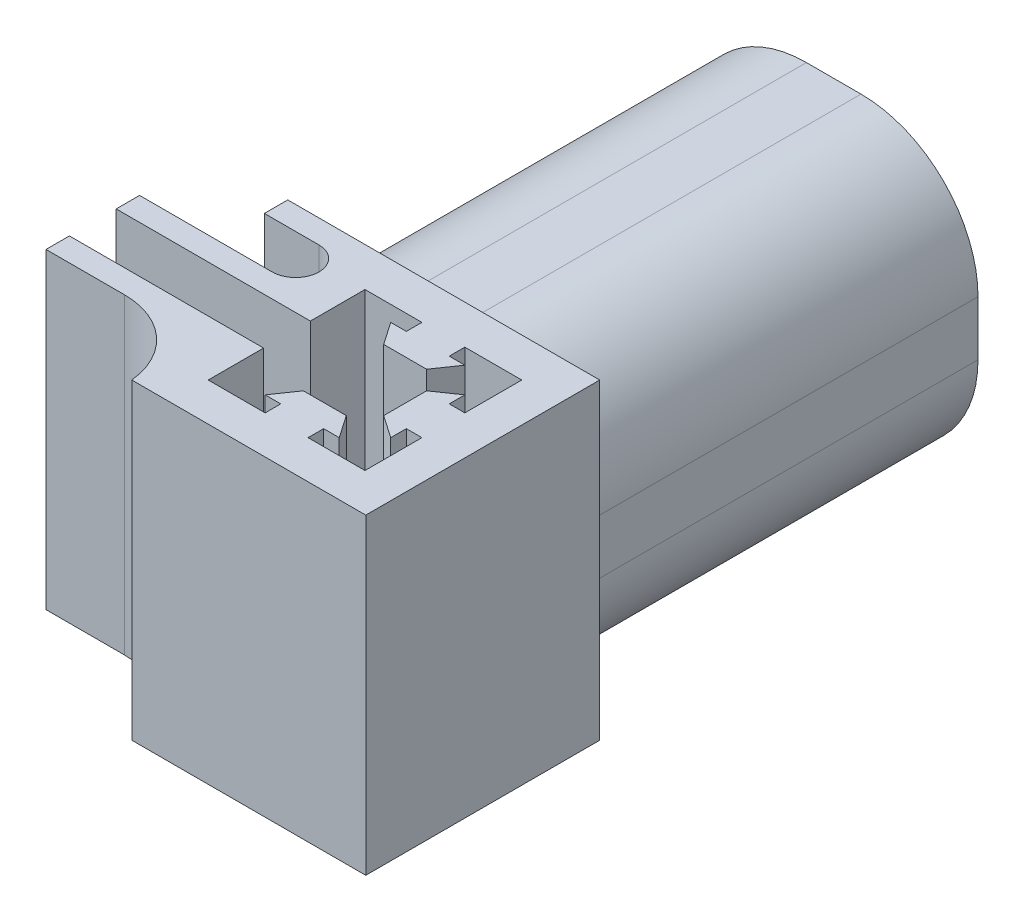
from build123d import *

# Parameters (mm, degrees)
SKETCH5_W           = 30
SKETCH5_H           = 30
BOSS_EXTRUDE3_DEPTH = 40
CUT_EXTRUDE1_DEPTH  = 50
SKETCH8_W           = 4.9
SKETCH8_H           = 6
CUT_EXTRUDE3_DEPTH  = 40
SKETCH10_W          = 3
SKETCH10_H          = 40
BOSS_EXTRUDE4_DEPTH = 10
SKETCH11_W          = 37
SKETCH11_H          = 37
BOSS_EXTRUDE5_DEPTH = 50
SKETCH14_R          = 1.5
CUT_EXTRUDE4_DEPTH  = 20
FILLET2_R           = 15
FILLET3_R           = 3
FILLET4_R           = 10
SKETCH15_W          = 3
SKETCH15_H          = 40
BOSS_EXTRUDE6_DEPTH = 10


# Some blends are built 0.0001 mm under size
with BuildPart() as part:
    # Sketch5 → Boss-Extrude3 (new body)
    with BuildSketch(Plane(origin=(0, 0, 0), x_dir=(1, 0, 0), z_dir=(0, 1, 0))):
        with Locations((15, -15)):
            Rectangle(SKETCH5_W, SKETCH5_H)
    extrude(amount=BOSS_EXTRUDE3_DEPTH)

    # Sketch6 → Cut-Extrude1 (cut)
    with BuildSketch(Plane(origin=(0, 40, 0), x_dir=(1, 0, 0), z_dir=(0, 1, 0))):
        Polygon((12.2, -5), (4.9, -5), (4.9, -15.05), (20.1, -15.05), (20.1, -12.3), (23, -10.3), (23, -12.3), (25, -12.3), (25, -5), (17.7, -5), (17.7, -7), (19.7, -7), (17.7, -9.9), (12.2, -9.9), (10.2, -7), (12.2, -7), align=None)
        Polygon((20.1, -15.05), (4.9, -15.05), (4.9, -25.1), (12.2, -25.1), (12.2, -23.1), (10.2, -23.1), (12.2, -20.2), (17.7, -20.2), (19.7, -23.1), (17.7, -23.1), (17.7, -25.1), (25, -25.1), (25, -17.8), (23, -17.8), (23, -19.8), (20.1, -17.8), align=None)
    extrude(amount=-CUT_EXTRUDE1_DEPTH, mode=Mode.SUBTRACT)

    # Sketch8 → Cut-Extrude3 (cut)
    with BuildSketch(Plane(origin=(0, 40, 0), x_dir=(1, 0, 0), z_dir=(0, 1, 0))):
        with Locations((2.45, -15)):
            Rectangle(SKETCH8_W, SKETCH8_H)
    extrude(amount=-CUT_EXTRUDE3_DEPTH, mode=Mode.SUBTRACT)

    # Sketch10 → Boss-Extrude4 (add)
    with BuildSketch(Plane.ZY):
        with Locations((1.5, 20)):
            Rectangle(SKETCH10_W, SKETCH10_H)
        with Locations((10.5, 20)):
            Rectangle(SKETCH10_W, SKETCH10_H)
        with Locations((19.5, 20)):
            Rectangle(SKETCH10_W, SKETCH10_H)
    extrude(amount=BOSS_EXTRUDE4_DEPTH)

    # Sketch11 → Boss-Extrude5 (add)
    with BuildSketch(Plane(origin=(0, 0, 0), x_dir=(-1, 0, 0), z_dir=(0, 0, -1))):
        with Locations((-10, 20)):
            Rectangle(SKETCH11_W, SKETCH11_H)
    extrude(amount=BOSS_EXTRUDE5_DEPTH)

    # Sketch14 → Cut-Extrude4 (cut)
    with BuildSketch(Plane(origin=(0, 0, -50), x_dir=(-1, 0, 0), z_dir=(0, 0, -1))):
        with Locations((-10.1, 32.75)):
            Circle(SKETCH14_R)
        with Locations((1.591342951, 12.5)):
            Circle(SKETCH14_R)
        with Locations((-21.791342951, 12.5)):
            Circle(SKETCH14_R)
    extrude(amount=-CUT_EXTRUDE4_DEPTH, mode=Mode.SUBTRACT)

    # Fillet2
    fillet2_edges = [part.edges().sort_by_distance(p)[0] for p in [
        (28.5, 38.5, -25),
        (28.5, 1.5, -25),
        (-8.5, 1.5, -25),
        (-8.5, 38.5, -25),
    ]]
    fillet(fillet2_edges, radius=FILLET2_R)

    # Fillet3
    fillet3_edges = [part.edges().sort_by_distance(p)[0] for p in [
        (0, 20, 3),
        (0, 20, 9),
    ]]
    fillet(fillet3_edges, radius=FILLET3_R - 0.0001)  # a hair under: the kernel refuses the full size

    # Fillet4
    # the kernel refuses this fillet: 10 mm, written as the material it adds along each edge
    with BuildSketch(Plane(origin=(0, 0, 21), x_dir=(0, 0, 1), z_dir=(0, 1, 0))) as fillet4_piece_1:
        with BuildLine():
            CenterArc((10, -9.949874371), FILLET4_R, 95.739170477, 84.260829523)
            Line((0, -9.949874371), (-0.2, -9.949874371))
            Line((-0.2, -9.949874371), (-0.2, 0))
            Line((-0.2, 0), (0, 0.2))
            ThreePointArc((0, 0.2), (4.5, 0.2), (8.98, 0.198997487))
            Line((8.98, 0.198997487), (9, 0))
        make_face()
    extrude(amount=40)

    # Sketch15 → Boss-Extrude6 (add)
    with BuildSketch(Plane.ZY.offset(10)):
        with Locations((10.5, 20)):
            Rectangle(SKETCH15_W, SKETCH15_H)
        with Locations((19.5, 20)):
            Rectangle(SKETCH15_W, SKETCH15_H)
    extrude(amount=BOSS_EXTRUDE6_DEPTH)


solid = part.part
